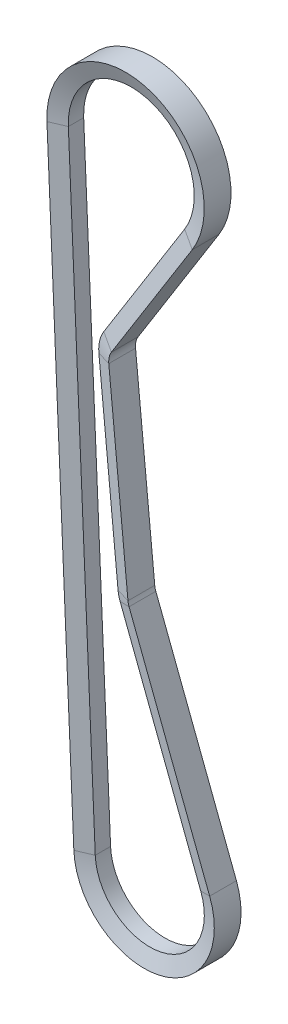
from build123d import *


with BuildPart() as part:
    # Sweep1: sweep along a path in Sketch2
    with BuildLine(Plane.XY) as sweep1_path:
        Line((-24.976306297, -1.088174507), (-34.551351594, 218.682884797))
        ThreePointArc((-34.551351594, 218.682884797), (0.563103614, 246.97572806), (17.155519841, 205.044812638))
        Line((17.155519841, 205.044812638), (-11.610562526, 159.091719659))
        ThreePointArc((-11.610562526, 159.091719659), (-12.409819241, 157.174865211), (-12.547848202, 155.102646526))
        Line((-12.547848202, 155.102646526), (-5.71588268, 85.436842525))
        ThreePointArc((-5.71588268, 85.436842525), (-5.576361123, 84.597799712), (-5.325956199, 83.784930423))
        Line((-5.325956199, 83.784930423), (23.345500661, 8.943578639))
        ThreePointArc((23.345500661, 8.943578639), (5.081722105, -24.478073871), (-24.976306297, -1.088174507))
    # Sketch3 → Sweep1 (sweep)
    with BuildSketch(Plane(origin=(23.345500661, 8.943578639, 0), x_dir=(-0.9338200264599492, -0.35774314554207753, 0), z_dir=(0.35774314554207753, -0.9338200264599492, 0))):
        Polygon((0, -4.7625), (0, 4.7625), (5.588, 2.728634331), (5.588, -2.728634331), align=None)
    sweep(path=sweep1_path.line)


solid = part.part
